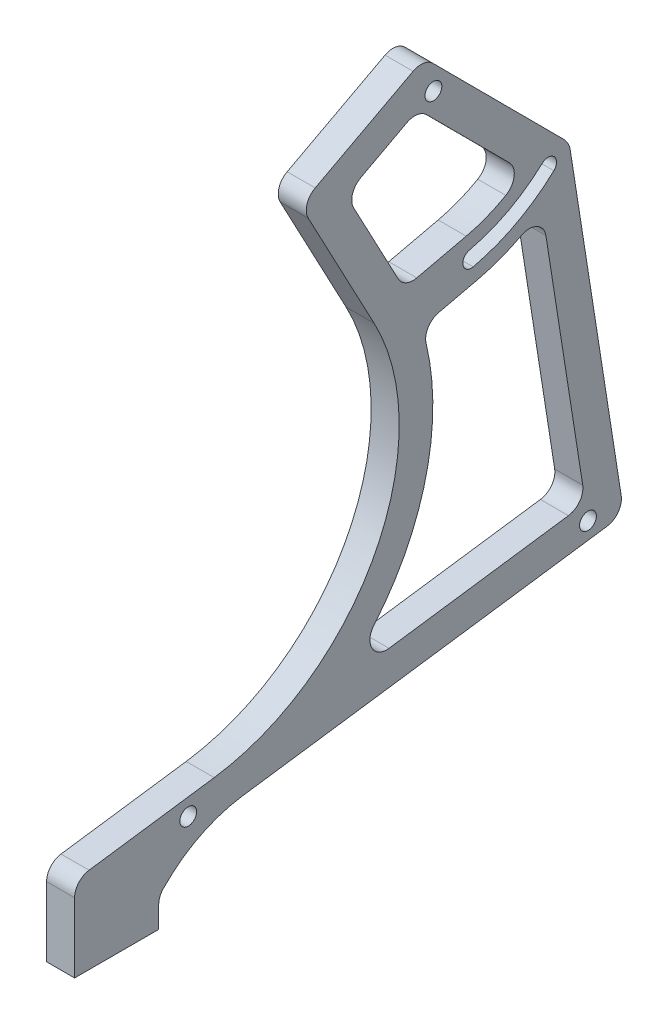
from build123d import *

# Parameters (mm, degrees)
SKETCH1_R                   = 1.5
BOSS_EXTRUDE1_DEPTH         = 5
FILLET1_R                   = 3
TAP_DRILL_FOR_M3_TAP1_D     = 2.5
TAP_DRILL_FOR_M3_TAP1_DEPTH = 7
TAP_DRILL_FOR_M3_TAP1_TIP   = 0.751075774
CUT_EXTRUDE2_REACH          = 149.267
SKETCH7_R                   = 1.5


with BuildPart() as part:
    # Sketch1 → Boss-Extrude1 (new body)
    with BuildSketch(Plane(origin=(0, 0, 0), x_dir=(0, 0, -1), z_dir=(1, 0, 0))):
        with BuildLine():
            Line((0, 0), (0, 15))
            Line((0, 15), (24.902534651, 18.499823006))
            ThreePointArc((24.902534651, 18.499823006), (53.721555291, 39.056230652), (53.412643103, 74.454061366))
            Line((53.412643103, 74.454061366), (40.267439345, 99.176593966))
            Line((40.267439345, 99.176593966), (62.341129166, 110.913383036))
            Line((62.341129166, 110.913383036), (87.292806812, 85.883380245))
            ThreePointArc((87.292806812, 85.883380245), (88.026729834, 84.869937856), (88.411619345, 83.679320981))
            Line((88.411619345, 83.679320981), (97.046270737, 28.638963894))
            Line((97.046270737, 28.638963894), (97.976287582, 22.710703803))
            Line((97.976287582, 22.710703803), (30, 13.157259606))
            ThreePointArc((30, 13.157259606), (21.7610626, 10.437426941), (15, 5))
            Line((15, 5), (15, 0))
            Line((15, 0), (0, 0))
        make_face()
        with Locations((64, 105)):
            Circle(SKETCH1_R, mode=Mode.SUBTRACT)
        with BuildLine():
            Line((46.956404383, 21.599292267), (91.103903246, 27.803818607))
            Line((91.103903246, 27.803818607), (83.376414926, 77.061593735))
            ThreePointArc((83.376414926, 77.061593735), (77.759315759, 73.90850229), (71.648335848, 71.871417797))
            Line((71.648335848, 71.871417797), (61.900350623, 69.620918081))
            ThreePointArc((61.900350623, 69.620918081), (61.897210429, 43.285864046), (46.956404383, 21.599292267))
        make_face(mode=Mode.SUBTRACT)
        with BuildLine():
            Line((80.108700039, 84.591428686), (61.231449963, 103.527935833))
            Line((61.231449963, 103.527935833), (48.381954278, 96.695737786))
            Line((48.381954278, 96.695737786), (58.793684809, 77.114120627))
            Line((58.793684809, 77.114120627), (69.848727413, 79.666378316))
            ThreePointArc((69.848727413, 79.666378316), (75.251497028, 81.560635362), (80.108700039, 84.591428686))
        make_face(mode=Mode.SUBTRACT)
        with BuildLine():
            ThreePointArc((71.085958212, 74.307342959), (78.788354228, 77.187150825), (85.482948342, 81.962358399))
            ThreePointArc((85.482948342, 81.962358399), (85.556981354, 84.082386492), (83.436953262, 84.156419504))
            ThreePointArc((83.436953262, 84.156419504), (77.379939539, 79.835993604), (70.411105049, 77.230453154))
            ThreePointArc((70.411105049, 77.230453154), (69.286976533, 75.431471475), (71.085958212, 74.307342959))
        make_face(mode=Mode.SUBTRACT)
    extrude(amount=BOSS_EXTRUDE1_DEPTH)

    # Fillet1
    fillet1_edges = [part.edges().sort_by_distance(p)[0] for p in [
        (2.5, 27.803818607, -91.103903246),
        (2.5, 21.599292267, -46.956404383),
        (2.5, 84.591428686, -80.108700039),
        (2.5, 110.913383036, -62.341129166),
        (2.5, 103.527935833, -61.231449963),
        (2.5, 96.695737786, -48.381954278),
        (2.5, 77.114120627, -58.793684809),
        (2.5, 15, 0),
        (2.5, 69.620918081, -61.900350623),
        (2.5, 77.061593735, -83.376414926),
        (2.5, 99.176593966, -40.267439345),
        (2.5, 22.710703803, -97.976287582),
        (2.5, 5, -15),
    ]]
    fillet(fillet1_edges, radius=FILLET1_R)

    # Tap Drill for M3 Tap1
    with Locations(Plane(origin=(0, 0, 0), x_dir=(-1, 0, 0), z_dir=(0, -1, 0))):
        with Locations((-2.5, 5.5), (-2.5, 70.5)):
            Hole(TAP_DRILL_FOR_M3_TAP1_D / 2, depth=TAP_DRILL_FOR_M3_TAP1_DEPTH)
            with Locations((0, 0, -(TAP_DRILL_FOR_M3_TAP1_DEPTH + TAP_DRILL_FOR_M3_TAP1_TIP / 2))):  # 118° drill point
                Cone(0, TAP_DRILL_FOR_M3_TAP1_D / 2, TAP_DRILL_FOR_M3_TAP1_TIP, mode=Mode.SUBTRACT)

    # Sketch7 → Cut-Extrude2 (cut, up to next)
    with BuildSketch(Plane(origin=(5, 0, 0), x_dir=(0, 0, -1), z_dir=(1, 0, 0)), mode=Mode.PRIVATE) as cut_extrude2_sk1:
        with Locations((20.269610719, 14.819225292)):
            Circle(SKETCH7_R)
    cut_extrude2_tool1 = extrude(cut_extrude2_sk1.sketch, amount=-CUT_EXTRUDE2_REACH, mode=Mode.PRIVATE) & part.part
    # Sketch7 → Cut-Extrude2 (cut, up to next)
    with BuildSketch(Plane(origin=(5, 0, 0), x_dir=(0, 0, -1), z_dir=(1, 0, 0)), mode=Mode.PRIVATE) as cut_extrude2_sk2:
        with Locations((91.568911669, 24.839688561)):
            Circle(SKETCH7_R)
    cut_extrude2_tool2 = extrude(cut_extrude2_sk2.sketch, amount=-CUT_EXTRUDE2_REACH, mode=Mode.PRIVATE) & part.part
    add(cut_extrude2_tool1.solids().sort_by_distance((5, 14.819225, -20.269611))[0], mode=Mode.SUBTRACT)
    add(cut_extrude2_tool2.solids().sort_by_distance((5, 24.839689, -91.568912))[0], mode=Mode.SUBTRACT)


solid = part.part
